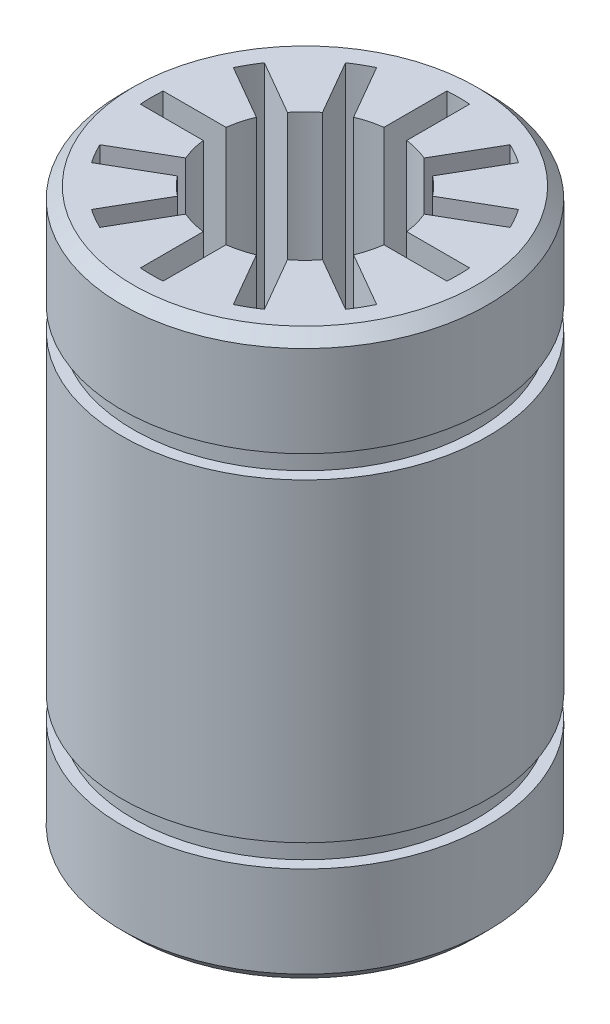
from build123d import *

# Parameters (mm, degrees)
CHANFREIN1_SIZE         = 0.5
ENL_V_MAT_EXTRU_1_DEPTH = 28.28126444


with BuildPart() as part:
    # Esquisse2 → Révolution1 (revolve)
    with BuildSketch(Plane.XY):
        Polygon((0, 12.4), (-8.03826441, 12.4), (-8.03826441, 7.9), (-7.53826441, 7.9), (-7.53826441, 6.9), (-8.03826441, 6.9), (-8.03826441, -6.9), (-7.53826441, -6.9), (-7.53826441, -7.9), (-8.03826441, -7.9), (-8.03826441, -12.4), (0, -12.4), align=None)
    revolve(axis=Axis((0, 0, 0), (0, -1, 0)))

    # Chanfrein1
    chanfrein1_edges = [part.edges().sort_by_distance(p)[0] for p in [
        (8.03826441, -12.4, 0),
        (8.03826441, 12.4, 0),
    ]]
    chamfer(chanfrein1_edges, length=CHANFREIN1_SIZE)

    # Esquisse3 → Enlèv. mat.-Extru.1 (cut, through all)
    with BuildSketch(Plane(origin=(0, 12.4, 0), x_dir=(1, 0, 0), z_dir=(0, 1, 0))):
        with BuildLine():
            Line((-0.5, 6.731456009), (-0.5, 3.968626967))
            ThreePointArc((-0.5, 3.968626967), (-1.03527618, 3.863703305), (-1.551300781, 3.686931771))
            Line((-1.551300781, 3.686931771), (-2.932715303, 6.079611908))
            ThreePointArc((-2.932715303, 6.079611908), (-3.375, 5.845671476), (-3.798740706, 5.579611908))
            Line((-3.798740706, 5.579611908), (-2.417326185, 3.186931771))
            ThreePointArc((-2.417326185, 3.186931771), (-2.828427125, 2.828427125), (-3.186931771, 2.417326185))
            Line((-3.186931771, 2.417326185), (-5.579611908, 3.798740706))
            ThreePointArc((-5.579611908, 3.798740706), (-5.845671476, 3.375), (-6.079611908, 2.932715303))
            Line((-6.079611908, 2.932715303), (-3.686931771, 1.551300781))
            ThreePointArc((-3.686931771, 1.551300781), (-3.863703305, 1.03527618), (-3.968626967, 0.5))
            Line((-3.968626967, 0.5), (-6.731456009, 0.5))
            ThreePointArc((-6.731456009, 0.5), (-6.75, 0), (-6.731456009, -0.5))
            Line((-6.731456009, -0.5), (-3.968626967, -0.5))
            ThreePointArc((-3.968626967, -0.5), (-3.863703305, -1.03527618), (-3.686931771, -1.551300781))
            Line((-3.686931771, -1.551300781), (-6.079611908, -2.932715303))
            ThreePointArc((-6.079611908, -2.932715303), (-5.845671476, -3.375), (-5.579611908, -3.798740706))
            Line((-5.579611908, -3.798740706), (-3.186931771, -2.417326185))
            ThreePointArc((-3.186931771, -2.417326185), (-2.828427125, -2.828427125), (-2.417326185, -3.186931771))
            Line((-2.417326185, -3.186931771), (-3.798740706, -5.579611908))
            ThreePointArc((-3.798740706, -5.579611908), (-3.375, -5.845671476), (-2.932715303, -6.079611908))
            Line((-2.932715303, -6.079611908), (-1.551300781, -3.686931771))
            ThreePointArc((-1.551300781, -3.686931771), (-1.03527618, -3.863703305), (-0.5, -3.968626967))
            Line((-0.5, -3.968626967), (-0.5, -6.731456009))
            ThreePointArc((-0.5, -6.731456009), (0, -6.75), (0.5, -6.731456009))
            Line((0.5, -6.731456009), (0.5, -3.968626967))
            ThreePointArc((0.5, -3.968626967), (1.03527618, -3.863703305), (1.551300781, -3.686931771))
            Line((1.551300781, -3.686931771), (2.932715303, -6.079611908))
            ThreePointArc((2.932715303, -6.079611908), (3.375, -5.845671476), (3.798740706, -5.579611908))
            Line((3.798740706, -5.579611908), (2.417326185, -3.186931771))
            ThreePointArc((2.417326185, -3.186931771), (2.828427125, -2.828427125), (3.186931771, -2.417326185))
            Line((3.186931771, -2.417326185), (5.579611908, -3.798740706))
            ThreePointArc((5.579611908, -3.798740706), (5.845671476, -3.375), (6.079611908, -2.932715303))
            Line((6.079611908, -2.932715303), (3.686931771, -1.551300781))
            ThreePointArc((3.686931771, -1.551300781), (3.863703305, -1.03527618), (3.968626967, -0.5))
            Line((3.968626967, -0.5), (6.731456009, -0.5))
            ThreePointArc((6.731456009, -0.5), (6.75, 0), (6.731456009, 0.5))
            Line((6.731456009, 0.5), (3.968626967, 0.5))
            ThreePointArc((3.968626967, 0.5), (3.863703305, 1.03527618), (3.686931771, 1.551300781))
            Line((3.686931771, 1.551300781), (6.079611908, 2.932715303))
            ThreePointArc((6.079611908, 2.932715303), (5.845671476, 3.375), (5.579611908, 3.798740706))
            Line((5.579611908, 3.798740706), (3.186931771, 2.417326185))
            ThreePointArc((3.186931771, 2.417326185), (2.828427125, 2.828427125), (2.417326185, 3.186931771))
            Line((2.417326185, 3.186931771), (3.798740706, 5.579611908))
            ThreePointArc((3.798740706, 5.579611908), (3.375, 5.845671476), (2.932715303, 6.079611908))
            Line((2.932715303, 6.079611908), (1.551300781, 3.686931771))
            ThreePointArc((1.551300781, 3.686931771), (1.03527618, 3.863703305), (0.5, 3.968626967))
            Line((0.5, 3.968626967), (0.5, 6.731456009))
            ThreePointArc((0.5, 6.731456009), (0, 6.75), (-0.5, 6.731456009))
        make_face()
    extrude(amount=-ENL_V_MAT_EXTRU_1_DEPTH, mode=Mode.SUBTRACT)


solid = part.part
